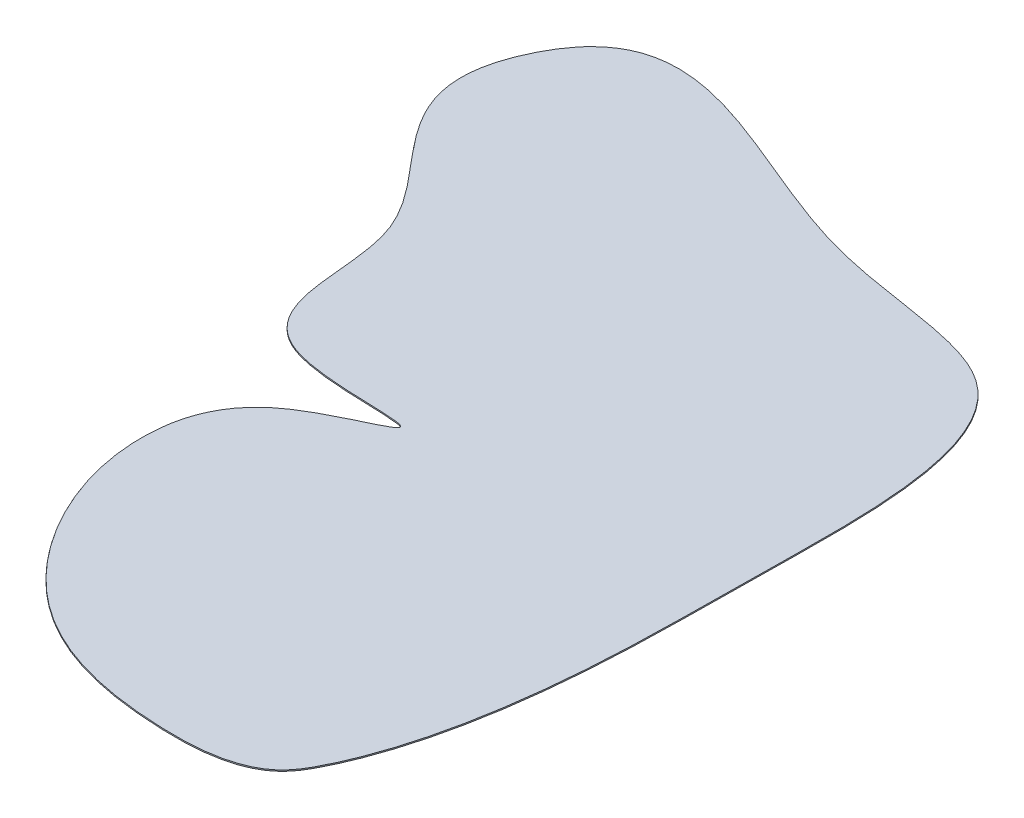
from build123d import *

# Parameters (mm, degrees)
SKETCH2_W                = 2743.2
SKETCH2_H                = 2743.2
BOSS_EXTRUDE5_DEPTH      = 2.54
BOSS_EXTRUDE6_DEPTH      = 1.5875
BOSS_EXTRUDE6_DEPTH_BACK = 1.5875
SKETCH5_2_OUTSIDE_W      = 3531.324
SKETCH5_2_OUTSIDE_H      = 3603.188
CUT_EXTRUDE1_DEPTH       = 3880.471475948


with BuildPart() as part:
    # Sketch2 → Boss-Extrude5 (new body)
    with BuildSketch(Plane(origin=(0, 0, 0), x_dir=(1, 0, 0), z_dir=(0, 1, 0))):
        with Locations((1371.6, -1371.6)):
            Rectangle(SKETCH2_W, SKETCH2_H)
    extrude(amount=BOSS_EXTRUDE5_DEPTH)

    # Sketch5 → Boss-Extrude6 (add, two sides: drawn at the far end of the back side and taken through both)
    with BuildSketch(Plane(origin=(0, 2.54, 0), x_dir=(1, 0, 0), z_dir=(0, 1, 0)).offset(-BOSS_EXTRUDE6_DEPTH_BACK)):
        with BuildLine():
            add(Edge.make_bspline(
                [(508.214752154, -36.449395209), (466.376568522, -88.257867326), (273.307055682, -491.025767724), (878.115032696, -756.964700406), (663.687631754, -1474.95664682), (1518.033780913, -1382.918422603), (985.024199673, -1563.118804648), (841.43331328, -1982.318719343), (1137.370090815, -2567.703764918), (1643.589002046, -2719.585877185), (2078.119940882, -2695.396721914), (2253.6417614, -2382.178155578), (2342.359964667, -1856.493706796), (2333.565612912, -1207.294889931), (2374.353665445, -218.669920664), (1381.375601692, -263.950547308), (725.45165331, 232.556354062), (508.214752154, -36.449395209)],
                knots=[0, 0, 0, 0, 0.021292453, 0.117398978, 0.193524868, 0.246711358, 0.285262138, 0.327734488, 0.420663291, 0.498327396, 0.542346258, 0.556119525, 0.636060064, 0.710923218, 0.819224946, 0.88944294, 1, 1, 1, 1], degree=3))
        make_face()
    extrude(amount=BOSS_EXTRUDE6_DEPTH + BOSS_EXTRUDE6_DEPTH_BACK)

    # Sketch5<2> outside → Cut-Extrude1 (cut, through all)
    with BuildSketch(Plane(origin=(0, 2.54, 0), x_dir=(1, 0, 0), z_dir=(0, 1, 0))):
        with Locations((1371.6, -1335.668)):
            Rectangle(SKETCH5_2_OUTSIDE_W, SKETCH5_2_OUTSIDE_H)
        with BuildLine():
            add(Edge.make_bspline(
                [(508.214752154, -36.449395209), (466.376568522, -88.257867326), (273.307055682, -491.025767724), (878.115032696, -756.964700406), (663.687631754, -1474.95664682), (1518.033780913, -1382.918422603), (985.024199673, -1563.118804648), (841.43331328, -1982.318719343), (1137.370090815, -2567.703764918), (1643.589002046, -2719.585877185), (2078.119940882, -2695.396721914), (2253.6417614, -2382.178155578), (2342.359964667, -1856.493706796), (2333.565612912, -1207.294889931), (2374.353665445, -218.669920664), (1381.375601692, -263.950547308), (725.45165331, 232.556354062), (508.214752154, -36.449395209)],
                knots=[0, 0, 0, 0, 0.021292453, 0.117398978, 0.193524868, 0.246711358, 0.285262138, 0.327734488, 0.420663291, 0.498327396, 0.542346258, 0.556119525, 0.636060064, 0.710923218, 0.819224946, 0.88944294, 1, 1, 1, 1], degree=3))
        make_face(mode=Mode.SUBTRACT)
    extrude(amount=-CUT_EXTRUDE1_DEPTH, mode=Mode.SUBTRACT)


solid = part.part
